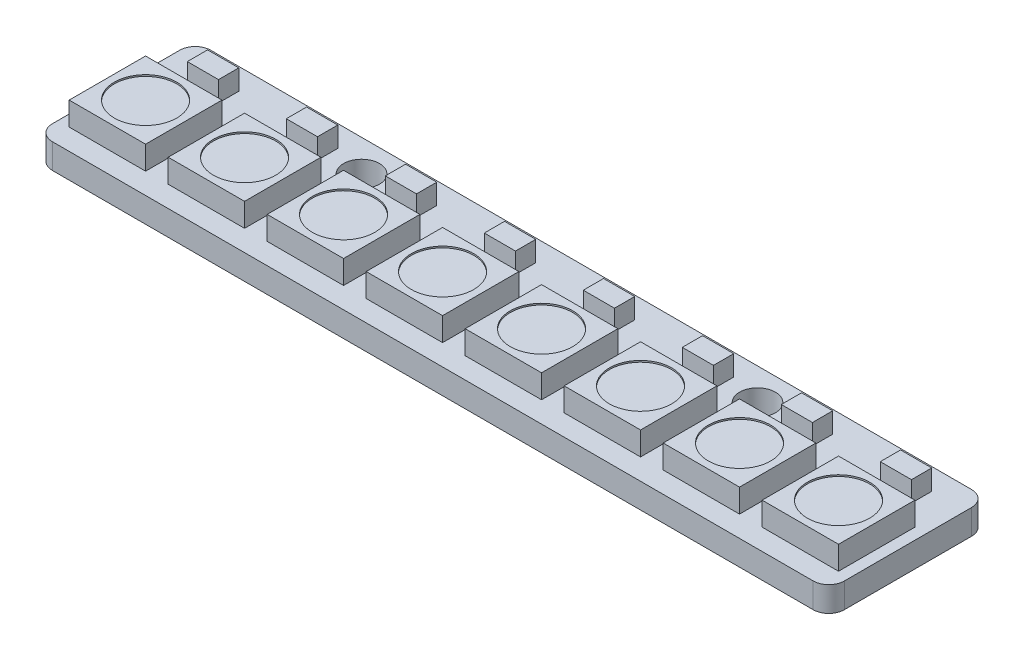
from build123d import *

# Parameters (mm, degrees)
SKETCH1_W         = 50.8
SKETCH1_H         = 10.16
SKETCH1_R         = 1.15
PCB_DEPTH         = 1.6
SKETCH2_W         = 4.9
SKETCH2_H         = 4.9
LEDS_DEPTH        = 1.5
SKETCH3_W         = 2
SKETCH3_H         = 1.3
CAPS_DEPTH        = 1.3
SKETCH4_R         = 2
LED_WINDOWS_DEPTH = 0.1
FILED_FILLETS_R   = 1


with BuildPart() as part:
    # Sketch1 → PCB (new body)
    with BuildSketch(Plane(origin=(0, 0, 0), x_dir=(1, 0, 0), z_dir=(0, 1, 0))):
        Rectangle(SKETCH1_W, SKETCH1_H)
        with Locations((-12.7, 3.048)):
            Circle(SKETCH1_R, mode=Mode.SUBTRACT)
        with Locations((12.7, 3.048)):
            Circle(SKETCH1_R, mode=Mode.SUBTRACT)
    extrude(amount=PCB_DEPTH)

    # Sketch2 → LEDs (add)
    with BuildSketch(Plane(origin=(0, 1.6, 0), x_dir=(1, 0, 0), z_dir=(0, 1, 0))):
        with Locations((3.175, -1.28)):
            Rectangle(SKETCH2_W, SKETCH2_H)
        with Locations((-3.175, -1.28)):
            Rectangle(SKETCH2_W, SKETCH2_H)
        with Locations((9.525, -1.28)):
            Rectangle(SKETCH2_W, SKETCH2_H)
        with Locations((15.875, -1.28)):
            Rectangle(SKETCH2_W, SKETCH2_H)
        with Locations((22.225, -1.28)):
            Rectangle(SKETCH2_W, SKETCH2_H)
        with Locations((-22.225, -1.28)):
            Rectangle(SKETCH2_W, SKETCH2_H)
        with Locations((-15.875, -1.28)):
            Rectangle(SKETCH2_W, SKETCH2_H)
        with Locations((-9.525, -1.28)):
            Rectangle(SKETCH2_W, SKETCH2_H)
    extrude(amount=LEDS_DEPTH)

    # Sketch3 → Caps (add)
    with BuildSketch(Plane(origin=(0, 1.6, 0), x_dir=(1, 0, 0), z_dir=(0, 1, 0))):
        with Locations((-15.875, 3.048)):
            Rectangle(SKETCH3_W, SKETCH3_H)
        with Locations((-22.225, 3.048)):
            Rectangle(SKETCH3_W, SKETCH3_H)
        with Locations((-9.525, 3.048)):
            Rectangle(SKETCH3_W, SKETCH3_H)
        with Locations((-3.175, 3.048)):
            Rectangle(SKETCH3_W, SKETCH3_H)
        with Locations((3.175, 3.048)):
            Rectangle(SKETCH3_W, SKETCH3_H)
        with Locations((9.525, 3.048)):
            Rectangle(SKETCH3_W, SKETCH3_H)
        with Locations((15.875, 3.048)):
            Rectangle(SKETCH3_W, SKETCH3_H)
        with Locations((22.225, 3.048)):
            Rectangle(SKETCH3_W, SKETCH3_H)
    extrude(amount=CAPS_DEPTH)

    # Sketch4 → LED windows (cut)
    with BuildSketch(Plane(origin=(0, 3.1, 0), x_dir=(1, 0, 0), z_dir=(0, 1, 0))):
        with Locations((-22.225, -1.28)):
            Circle(SKETCH4_R)
        with Locations((-15.875, -1.28)):
            Circle(SKETCH4_R)
        with Locations((-9.525, -1.28)):
            Circle(SKETCH4_R)
        with Locations((-3.175, -1.28)):
            Circle(SKETCH4_R)
        with Locations((3.175, -1.28)):
            Circle(SKETCH4_R)
        with Locations((9.525, -1.28)):
            Circle(SKETCH4_R)
        with Locations((15.875, -1.28)):
            Circle(SKETCH4_R)
        with Locations((22.225, -1.28)):
            Circle(SKETCH4_R)
    extrude(amount=-LED_WINDOWS_DEPTH, mode=Mode.SUBTRACT)

    # Filed fillets
    filed_fillets_edges = [part.edges().sort_by_distance(p)[0] for p in [
        (-25.4, 0.8, -5.08),
        (25.4, 0.8, -5.08),
        (25.4, 0.8, 5.08),
        (-25.4, 0.8, 5.08),
    ]]
    fillet(filed_fillets_edges, radius=FILED_FILLETS_R)


solid = part.part
